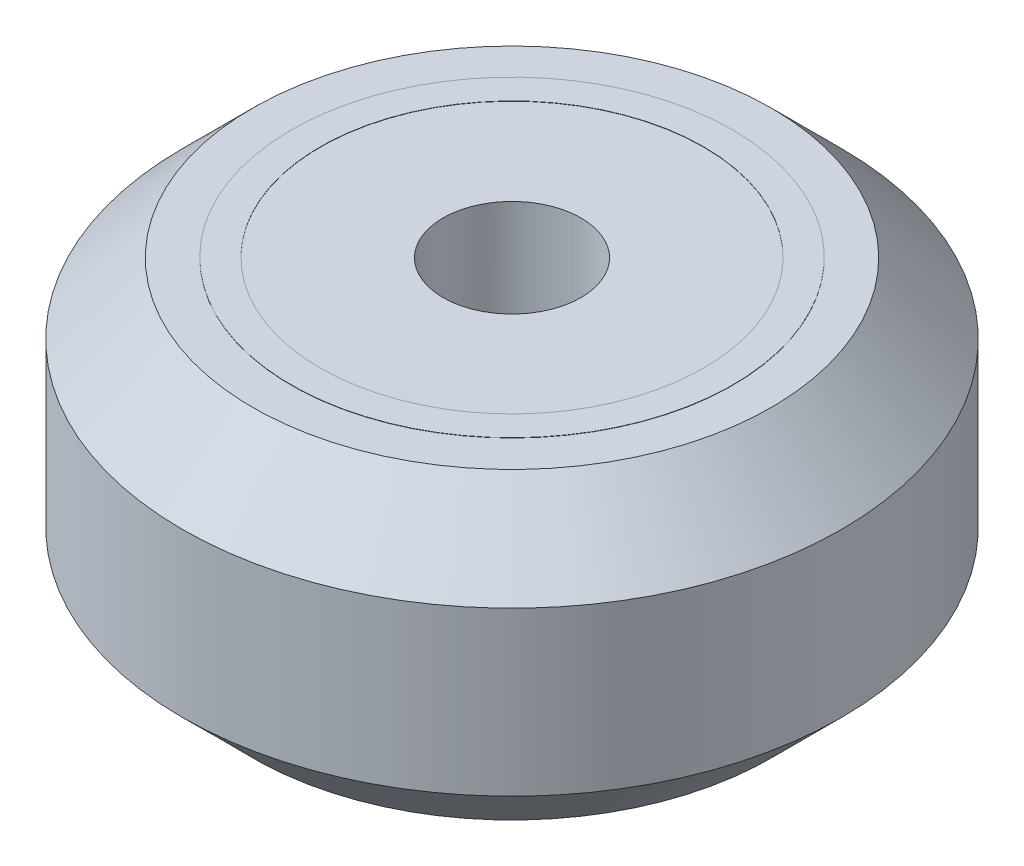
from build123d import *

# Parameters (mm, degrees)
CUT_EXTRUDE1_REACH  = 22.159
SKETCH2_R           = 2.5
SKETCH4_R           = 8
SKETCH4_R_2         = 6.945
BOSS_EXTRUDE1_DEPTH = 0.01
BOSS_EXTRUDE2_START = 0.01
SKETCH3_R           = 8
SKETCH3_R_2         = 6.945
SKETCH3_R_3         = 2.5
BOSS_EXTRUDE2_DEPTH = 0.01


with BuildPart() as part:
    # Sketch1 → Revolve1 (revolve)
    with BuildSketch(Plane.XY):
        Polygon((0, 5.5), (9.395, 5.5), (11.945, 2.95), (11.945, -2.95), (9.395, -5.5), (0, -5.5), align=None)
    revolve(axis=Axis((0, 0, 0), (0, 1, 0)))

    # Sketch2 → Cut-Extrude1 (cut, up to next)
    with BuildSketch(Plane(origin=(0, -5.5, 0), x_dir=(-1, 0, 0), z_dir=(0, -1, 0)), mode=Mode.PRIVATE) as cut_extrude1_sk1:
        Circle(SKETCH2_R)
    cut_extrude1_tool1 = extrude(cut_extrude1_sk1.sketch, amount=-CUT_EXTRUDE1_REACH, mode=Mode.PRIVATE) & part.part
    add(cut_extrude1_tool1.solids().sort_by_distance((0, -5.5, 0))[0], mode=Mode.SUBTRACT)

    # Sketch4 → Boss-Extrude1 (add)
    with BuildSketch(Plane(origin=(0, 5.5, 0), x_dir=(1, 0, 0), z_dir=(0, 1, 0))):
        Circle(SKETCH4_R)
        Circle(SKETCH4_R_2, mode=Mode.SUBTRACT)
    extrude(amount=BOSS_EXTRUDE1_DEPTH)

    # Sketch3 → Boss-Extrude2 (add)
    # profile 1 of 2: a face of its own
    with BuildSketch(Plane.XZ.offset(5.5).offset(BOSS_EXTRUDE2_START)):
        Circle(SKETCH3_R)
        Circle(SKETCH3_R_2, mode=Mode.SUBTRACT)
    # profile 2 of 2: a face of its own
    with BuildSketch(Plane.XZ.offset(5.5).offset(BOSS_EXTRUDE2_START)):
        Circle(SKETCH3_R_3)
    extrude(amount=-BOSS_EXTRUDE2_DEPTH)


with BuildPart() as boss_extrude2_piece_1:
    # of the separate pieces the step leaves, piece 1, a body of its own (boss_extrude2_pieces)
    add(part.part.solids().sort_by_distance((9.395, 5.5, 0))[0])


with BuildPart() as boss_extrude2_piece_2:
    # of the separate pieces the step leaves, piece 2, a body of its own (boss_extrude2_pieces)
    add(part.part.solids().sort_by_distance((2.5, -5.51, 0))[0])


solid = Compound([boss_extrude2_piece_1.part, boss_extrude2_piece_2.part])
